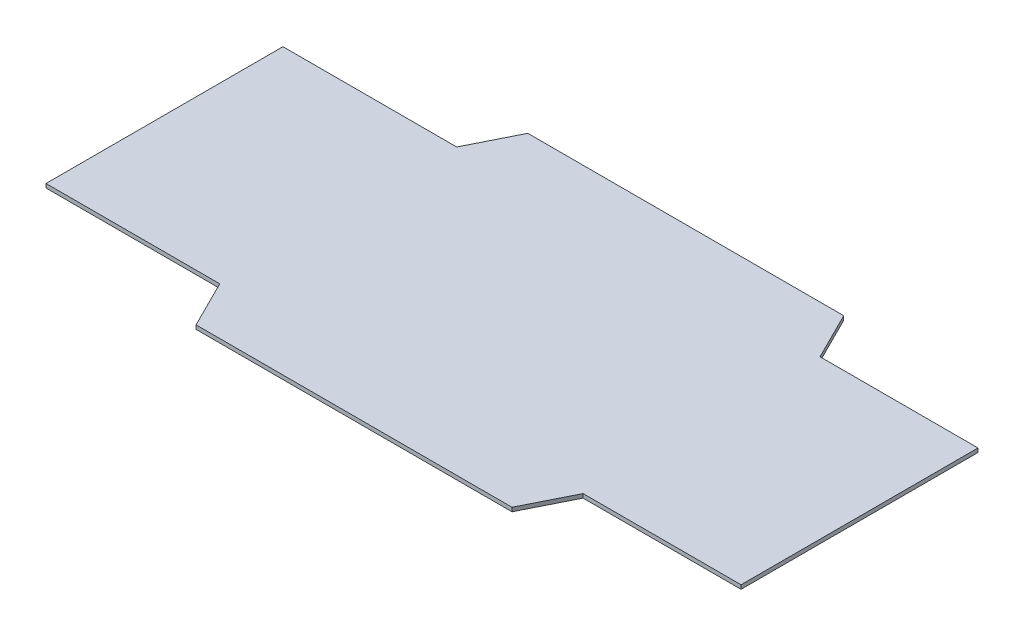
from build123d import *

# Parameters (mm, degrees)
BOSS_EXTRUDE1_DEPTH = 1.5875


with BuildPart() as part:
    # Sketch3 → Boss-Extrude1 (new, symmetric)
    with BuildSketch(Plane(origin=(0, 0, 0), x_dir=(1, 0, 0), z_dir=(0, 1, 0))):
        Polygon((-279.4, 95.25), (-139.7, 95.25), (-120.65, 133.35), (133.35, 133.35), (152.4, 95.25), (279.4, 95.25), (279.4, -95.25), (152.4, -95.25), (133.35, -133.35), (-120.65, -133.35), (-139.7, -95.25), (-279.4, -95.25), align=None)
    extrude(amount=BOSS_EXTRUDE1_DEPTH, both=True)


solid = part.part
